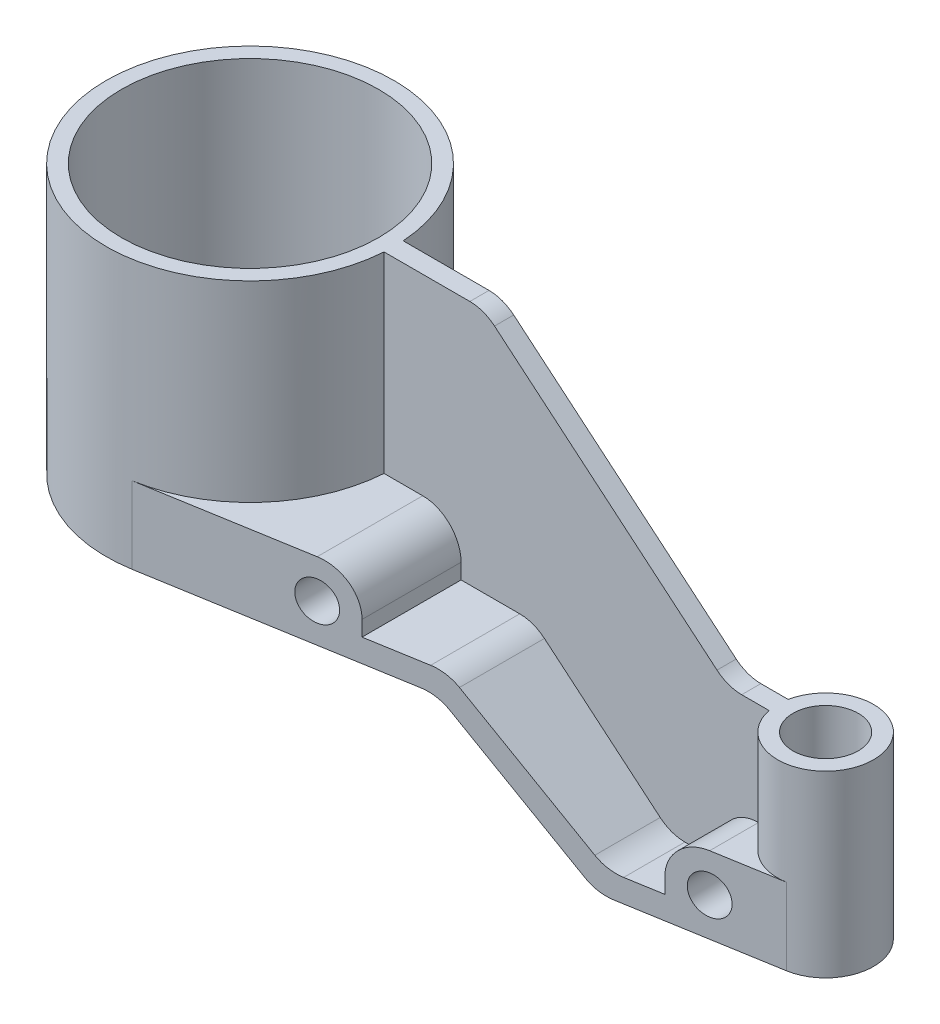
from build123d import *

# Parameters (mm, degrees)
SKETCH2_R                = 37.5
BOSS_EXTRUDE1_DEPTH      = 70
BOSS_EXTRUDE2_START      = -30
SKETCH2_3_R              = 12.5
BOSS_EXTRUDE2_DEPTH      = 46.666666667
EXTRUDE_THIN1_DEPTH      = 115
SKETCH5_W                = 100
SKETCH5_H                = 20
SKETCH5_W_2              = 50
BOSS_EXTRUDE3_DEPTH      = 230
CUT_EXTRUDE2_DEPTH       = 298.363414024
CUT_EXTRUDE2_DEPTH_BACK  = 298.363414024
SKETCH5_3_R              = 5
CUT_EXTRUDE1_START       = -30
CUT_EXTRUDE1_OUTLINE_W   = 217.5
CUT_EXTRUDE1_OUTLINE_H   = 230
CUT_EXTRUDE1_OUTLINE_R   = 8.5
CUT_EXTRUDE1_OUTLINE_R_2 = 33.5
CUT_EXTRUDE1_DEPTH       = 100
RIB1_START               = -2.5
RIB1_DEPTH               = 5
FILLET1_R                = 10


# Read off the part's stored shape, not the designer's step: Cut-Extrude1, Rib1
with BuildPart() as part:
    # Sketch2 → Boss-Extrude1 (new body)
    with BuildSketch(Plane(origin=(0, 0, 0), x_dir=(1, 0, 0), z_dir=(0, 1, 0))):
        with Locations(Location((0, 0, 0), (0, 0, 270))):
            Circle(SKETCH2_R)
    extrude(amount=BOSS_EXTRUDE1_DEPTH)



with BuildPart() as body_2:
    # Sketch2<3> → Boss-Extrude2 (new body)
    with BuildSketch(Plane(origin=(0, 0, 0), x_dir=(1, 0, 0), z_dir=(0, 1, 0)).offset(BOSS_EXTRUDE2_START)):
        with Locations(Location((150, 0, 0), (0, 0, 270))):
            Circle(SKETCH2_3_R)
    extrude(amount=BOSS_EXTRUDE2_DEPTH)


with BuildPart() as part_1:
    add(part.part)

    add(body_2.part)  # Extrude-Thin1 merges body 2
    # Sketch3 → Extrude-Thin1 (add, symmetric)
    with BuildSketch(Plane.XY):
        Polygon((-37.5, 0), (74.247392222, 0), (110, -30), (162.5, -30), (162.5, -24), (112.183821406, -24), (76.431213628, 6), (-37.5, 6), align=None)
    extrude(amount=EXTRUDE_THIN1_DEPTH, both=True)

    # Sketch5 → Boss-Extrude3 (add)
    with BuildSketch(Plane.XY.offset(115)):
        with Locations((7.5, 10)):
            Rectangle(SKETCH5_W, SKETCH5_H)
        with Locations((150, -20)):
            Rectangle(SKETCH5_W_2, SKETCH5_H)
    extrude(amount=-BOSS_EXTRUDE3_DEPTH)

    # Sketch5<3> → Cut-Extrude2 (cut, two sides: drawn at the far end of the back side and taken through both)
    with BuildSketch(Plane.XY.offset(115).offset(-CUT_EXTRUDE2_DEPTH_BACK)):
        with Locations((47.5, 10)):
            Circle(SKETCH5_3_R)
        with Locations((135, -20)):
            Circle(SKETCH5_3_R)
    extrude(amount=CUT_EXTRUDE2_DEPTH + CUT_EXTRUDE2_DEPTH_BACK, mode=Mode.SUBTRACT)

    # Cut-Extrude1 outline → Cut-Extrude1 (cut)
    # profile 1 of 3: a face of its own
    with BuildSketch(Plane(origin=(0, 0, 0), x_dir=(1, 0, 0), z_dir=(0, 1, 0)).offset(CUT_EXTRUDE1_START)):
        with Locations((66.25, 0)):
            Rectangle(CUT_EXTRUDE1_OUTLINE_W, CUT_EXTRUDE1_OUTLINE_H)
        with BuildLine():
            ThreePointArc((152.083333333, 12.325166215), (162.5, 0), (152.083333333, -12.325166215))
            Line((152.083333333, -12.325166215), (6.25, -36.975498644))
            ThreePointArc((6.25, -36.975498644), (-37.5, 0), (6.25, 36.975498644))
            Line((6.25, 36.975498644), (152.083333333, 12.325166215))
        make_face(mode=Mode.SUBTRACT)
    # profile 2 of 3: a face of its own
    with BuildSketch(Plane(origin=(0, 0, 0), x_dir=(1, 0, 0), z_dir=(0, 1, 0)).offset(CUT_EXTRUDE1_START)):
        with Locations((150, 0)):
            Circle(CUT_EXTRUDE1_OUTLINE_R)
    # profile 3 of 3: a face of its own
    with BuildSketch(Plane(origin=(0, 0, 0), x_dir=(1, 0, 0), z_dir=(0, 1, 0)).offset(CUT_EXTRUDE1_START)):
        Circle(CUT_EXTRUDE1_OUTLINE_R_2)
    extrude(amount=CUT_EXTRUDE1_DEPTH, mode=Mode.SUBTRACT)

    # Rib1 outline → Rib1 (add)
    with BuildSketch(Plane.XY.offset(RIB1_START)):
        Polygon((139, -10), (139, 16.666666667), (126.985277599, 16.666666667), (63.425085994, 70), (36, 70), (36, 20), (57.5, 20), (57.5, 6), (76.431213628, 6), (112.183821406, -24), (125, -24), (125, -10), align=None)
    extrude(amount=RIB1_DEPTH)

    # Fillet1
    fillet1_edges = [part_1.edges().sort_by_distance(p)[0] for p in [
        (76.431213628, 6, 13.806354192),
        (112.183821406, -24, 10.784707334),
        (110, -30, 0),
        (112.183821406, -24, -10.784707334),
        (125, -10, 9.701542547),
        (76.431213628, 6, -13.806354192),
        (57.5, 20, 15.406333767),
        (126.985277599, 16.666666667, 0),
        (63.425085994, 70, 0),
        (125, -10, -9.701542547),
        (57.5, 20, -15.406333767),
        (74.247392222, 0, 0),
    ]]
    fillet(fillet1_edges, radius=FILLET1_R)


solid = part_1.part
